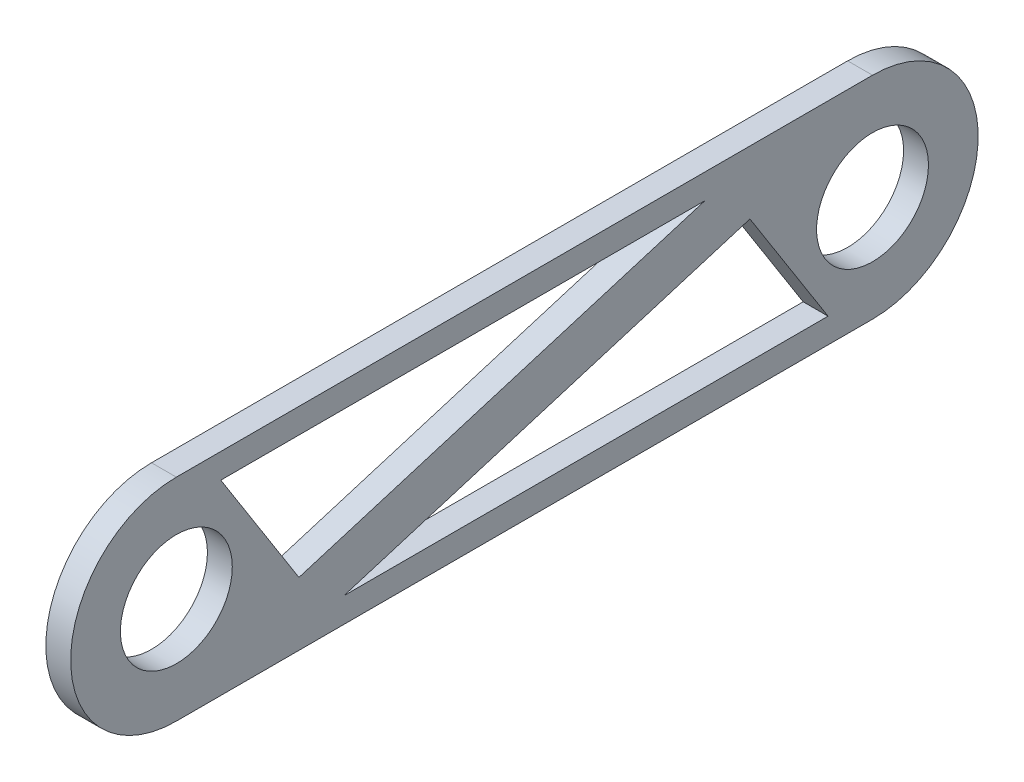
from build123d import *

# Parameters (mm, degrees)
SKETCH1_R           = 14.2875
BOSS_EXTRUDE1_DEPTH = 6.35


with BuildPart() as part:
    # Sketch1 → Boss-Extrude1 (new body)
    with BuildSketch(Plane(origin=(0, 0, 0), x_dir=(0, 0, -1), z_dir=(1, 0, 0))):
        with BuildLine():
            Line((177.8, 26.9875), (0, 26.9875))
            ThreePointArc((0, 26.9875), (-26.9875, 0), (0, -26.9875))
            Line((0, -26.9875), (177.8, -26.9875))
            ThreePointArc((177.8, -26.9875), (204.7875, 0), (177.8, 26.9875))
        make_face()
        Circle(SKETCH1_R, mode=Mode.SUBTRACT)
        Polygon((146.487365437, 10.845731969), (166.448840187, -20.6375), (42.777895421, -20.6375), align=None, mode=Mode.SUBTRACT)
        with Locations((177.8, 0)):
            Circle(SKETCH1_R, mode=Mode.SUBTRACT)
        Polygon((31.312634563, -10.845731969), (11.351159813, 20.6375), (135.022104579, 20.6375), align=None, mode=Mode.SUBTRACT)
    extrude(amount=BOSS_EXTRUDE1_DEPTH)


solid = part.part
